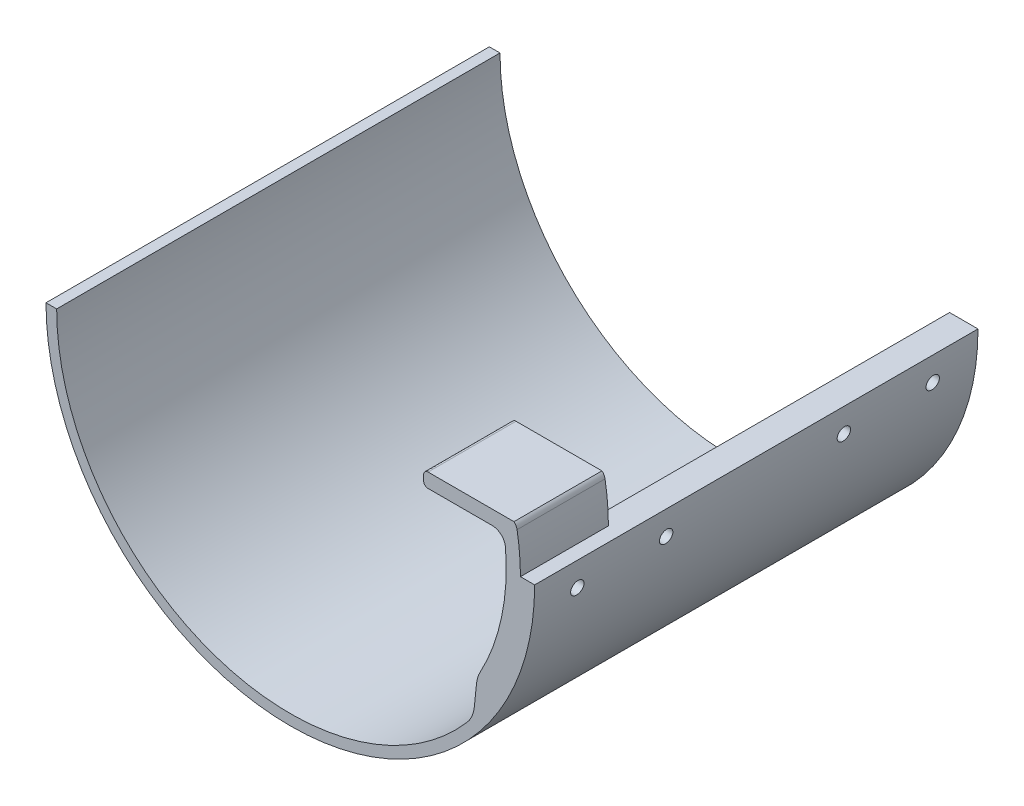
from build123d import *

# Parameters (mm, degrees)
EXTRUDE_1_DEPTH     = 99.8
SKETCH_7_R          = 1.5
CUT_EXTRUDE_6_DEPTH = 80
CUT_EXTRUDE_7_DEPTH = 80


with BuildPart() as part:
    # 草图1 → 凸台-拉伸1 (new body)
    with BuildSketch(Plane.XY):
        with BuildLine():
            Line((-55, 0), (-52.6, 0))
            ThreePointArc((-52.6, 0), (-18.385988634, -49.281998964), (39.74659399, -34.452405812))
            ThreePointArc((39.74659399, -34.452405812), (40.882352545, -32.645331036), (41.420765833, -30.58000349))
            Line((41.420765833, -30.58000349), (41.910264928, -25.795992674))
            ThreePointArc((41.910264928, -25.795992674), (42.185460224, -24.44340265), (42.720717667, -23.171108779))
            ThreePointArc((42.720717667, -23.171108779), (47.564735827, -9.977770578), (48.43095601, 4.05))
            ThreePointArc((48.43095601, 4.05), (47.472400425, 6.007940217), (45.441390824, 6.8))
            Line((45.441390824, 6.8), (31, 6.8))
            ThreePointArc((31, 6.8), (30.292893219, 7.092893219), (30, 7.8))
            Line((30, 7.8), (30, 9))
            ThreePointArc((30, 9), (30.292893219, 9.707106781), (31, 10))
            Line((31, 10), (50.344019583, 10))
            ThreePointArc((50.344019583, 10), (50.805346897, 9.459374484), (51.0484918, 8.791557597))
            ThreePointArc((51.0484918, 8.791557597), (51.611780996, 4.411809423), (51.8, 0))
            Line((51.8, 0), (55, 0))
            ThreePointArc((55, 0), (0, -55), (-55, 0))
        make_face()
    extrude(amount=EXTRUDE_1_DEPTH)

    # 草图7 → 切除-拉伸6 (cut)
    with BuildSketch(Plane(origin=(0, 0, 0), x_dir=(0.10066073352284005, 0.994920809274107, 0), z_dir=(-0.9949208092741069, 0.10066073352284004, 0))):
        with Locations((-0.136340344, -9.9)):
            Circle(SKETCH_7_R)
        with Locations((-0.136340344, -29.9)):
            Circle(SKETCH_7_R)
        with Locations((-0.136340344, -69.9)):
            Circle(SKETCH_7_R)
        with Locations((-0.136340344, -89.9)):
            Circle(SKETCH_7_R)
    extrude(amount=-CUT_EXTRUDE_6_DEPTH, mode=Mode.SUBTRACT)

    # 草图8 → 切除-拉伸7 (cut)
    with BuildSketch(Plane(origin=(0, 0, 0), x_dir=(-1, 0, 0), z_dir=(0, 0, -1))):
        with BuildLine():
            Line((-50.016978469, 22.875792113), (0, 0))
            Line((0, 0), (-55, 0))
            ThreePointArc((-55, 0), (-53.739807479, 11.70611345), (-50.016978469, 22.875792113))
        make_face()
    extrude(amount=-CUT_EXTRUDE_7_DEPTH, mode=Mode.SUBTRACT)


solid = part.part
